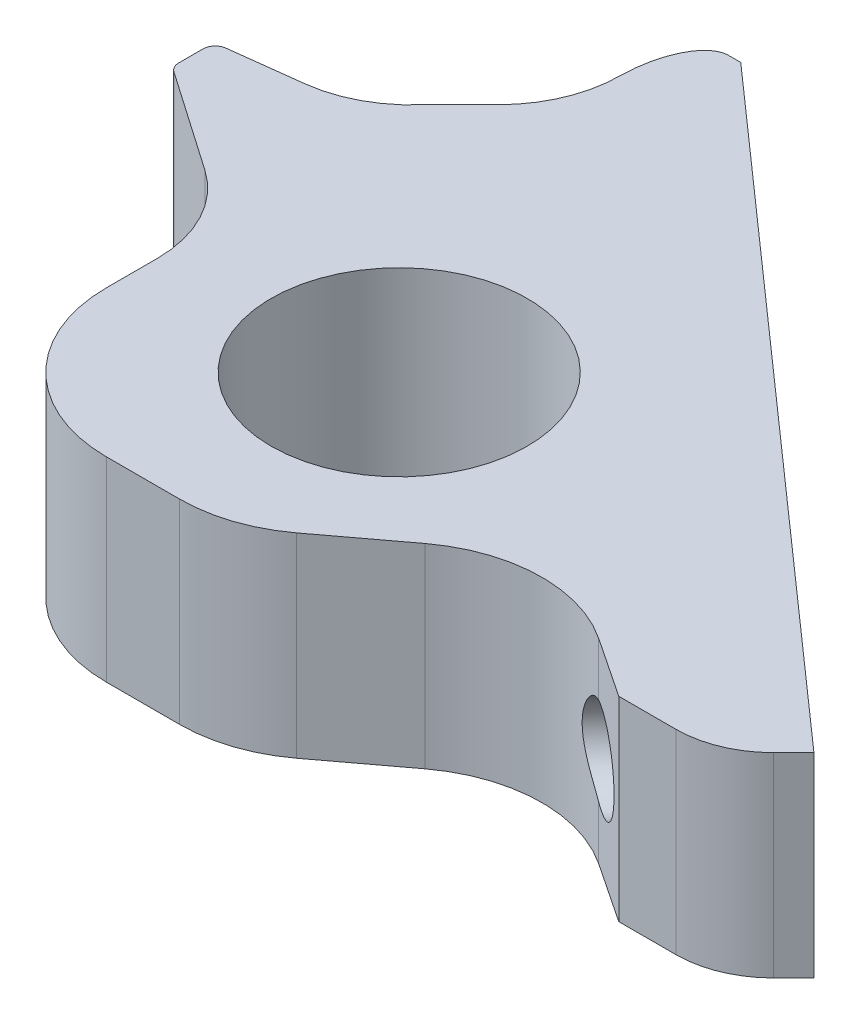
from build123d import *

# Parameters (mm, degrees)
SKETCH1_R           = 5.25
BOSS_EXTRUDE1_DEPTH = 8
FILLET1_SIZE        = 1.5
FILLET1_SIZE_2      = 3
FILLET2_R           = 5
CHAMFER1_SIZE2      = 0.798099646
CHAMFER1_SIZE       = 6.5
FILLET4_DEPTH       = 8
FILLET5_R           = 0.5
FILLET6_R           = 6
SKETCH2_R           = 1.85
CUT_EXTRUDE1_DEPTH  = 8
FILLET7_R           = 4


with BuildPart() as part:
    # Sketch1 → Boss-Extrude1 (new body)
    with BuildSketch(Plane(origin=(0, 0, 0), x_dir=(1, 0, 0), z_dir=(0, 1, 0))):
        Polygon((20, -7), (22, -5), (-4, 18), (-6, 18), (-6, 13), (-9, 10), (-9, 8.7), (-15.5, 8.7), (-15.5, 6.2), (-9, 1.7), (-9, -9), (2, -9), (10, -3), (16, -7), align=None)
        with Locations(Location((0, 0, 0), (0, 0, 270))):
            Circle(SKETCH1_R, mode=Mode.SUBTRACT)
    extrude(amount=BOSS_EXTRUDE1_DEPTH)

    # Fillet1
    # a fillet whose section is not a circle: 3, 1.5 mm, written as the material it takes off along each edge
    with BuildSketch(Plane(origin=(-6, -7.5, -18), x_dir=(1, 0, 0), z_dir=(0, 1, 0))) as fillet1_piece_1:
        with BuildLine():
            Bezier((FILLET1_SIZE, 0), (0, 0), (0, -FILLET1_SIZE_2), weights=[1, 0.707106781, 1])
            Line((0, -FILLET1_SIZE_2), (0, 0))
            Line((0, 0), (FILLET1_SIZE, 0))
        make_face()
    extrude(amount=23, mode=Mode.SUBTRACT)

    # Fillet2
    fillet2_edges = [part.edges().sort_by_distance(p)[0] for p in [
        (-6, 4, -13),
    ]]
    fillet(fillet2_edges, radius=FILLET2_R)

    # Chamfer1
    chamfer1_edges = [part.edges().sort_by_distance(p)[0] for p in [
        (-15.5, 4, -8.7),
    ]]
    chamfer1_side = [part.faces().sort_by_distance(p)[0] for p in [
        (-15.484038007, 4, -8.7),
    ]]
    chamfer(chamfer1_edges, length=CHAMFER1_SIZE - 0.0001, length2=CHAMFER1_SIZE2 - 0.0001, reference=chamfer1_side[0])  # a hair under: the kernel refuses the full size

    # Fillet4: read off the stored shape, not the designer's step
    # Fillet4 outline → Fillet4 (add)
    with BuildSketch(Plane(origin=(0, 0, 0), x_dir=(1, 0, 0), z_dir=(0, 1, 0))):
        with BuildLine():
            ThreePointArc((-11.153950106, 3.191196227), (-9.57110344, 1.40076867), (-9, -0.919764731))
            Line((-9, -0.919764731), (-9, 1.7))
            Line((-9, 1.7), (-11.153950106, 3.191196227))
        make_face()
        with BuildLine():
            Line((-9, 8.7), (-9, 10))
            ThreePointArc((-9, 10), (-10.428118078, 8.860869286), (-12.170105392, 8.310760001))
            Line((-12.170105392, 8.310760001), (-9, 8.7))
        make_face()
    extrude(amount=FILLET4_DEPTH)

    # Fillet5
    fillet5_edges = [part.edges().sort_by_distance(p)[0] for p in [
        (-15.5, 4, -6.2),
        (-15.5, 4, -7.902000354),
    ]]
    fillet(fillet5_edges, radius=FILLET5_R)

    # Fillet6
    fillet6_edges = [part.edges().sort_by_distance(p)[0] for p in [
        (10, 4, 3),
        (2, 4, 9),
        (-9, 4, 9),
    ]]
    fillet(fillet6_edges, radius=FILLET6_R)

    # Sketch2 → Cut-Extrude1 (cut)
    with BuildSketch(Plane(origin=(7.176763485, 0, -8.112863071), x_dir=(-0.7489965624903806, 0, -0.662573882203029), z_dir=(0.662573882203029, 0, -0.7489965624903806))):
        with Locations((7.92231613, 4)):
            Circle(SKETCH2_R)
        with Locations((-14.07768387, 4)):
            Circle(SKETCH2_R)
    extrude(amount=-CUT_EXTRUDE1_DEPTH, mode=Mode.SUBTRACT)

    # Fillet7
    fillet7_edges = [part.edges().sort_by_distance(p)[0] for p in [
        (20, 4, 7),
    ]]
    fillet(fillet7_edges, radius=FILLET7_R)


solid = part.part
